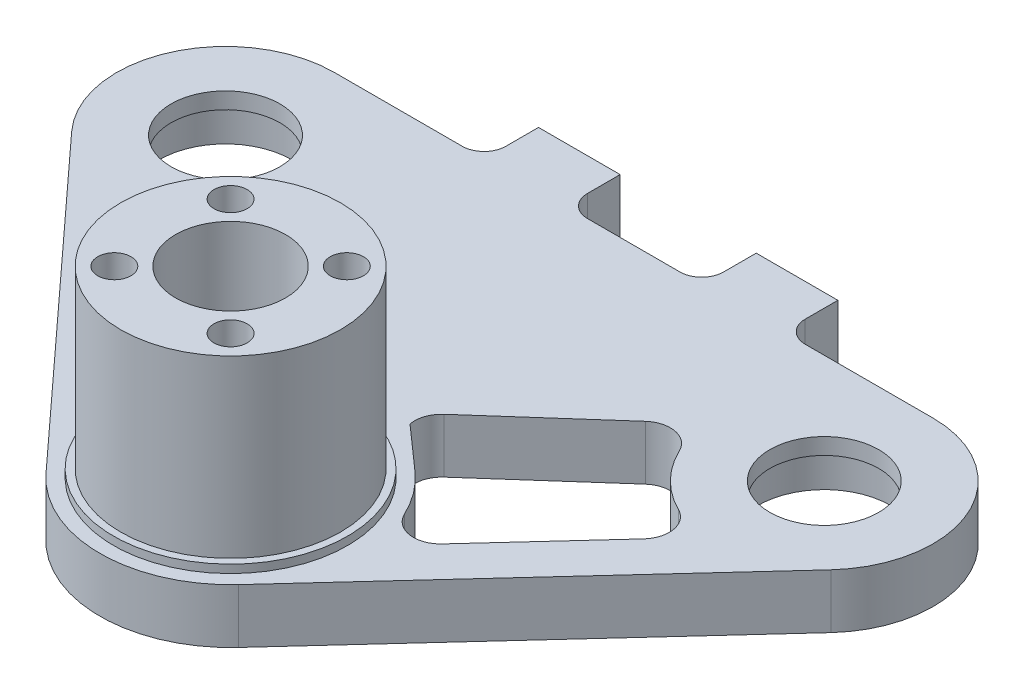
from build123d import *

# Parameters (mm, degrees)
SKETCH1_R                   = 10.1
SKETCH1_R_2                 = 10
MAIN_BODY_DEPTH             = 10
SKETCH2_R                   = 12.2
BEARING_RECESS_DEPTH        = 7
STANDOFF_SECTION_DEPTH      = 1.5
STANDOFF_SECTION_DEPTH_BACK = 11.5
SKETCH3_R                   = 21.5
SKETCH3_R_2                 = 10.1
SKETCH9_R                   = 20.2
SKETCH9_R_2                 = 10.1
BOSS_EXTRUDE1_DEPTH         = 33.7
EXTRA_GEOMETRY_DEPTH        = 10
SKETCH8_R                   = 2
CUT_EXTRUDE1_DEPTH          = 6
SKETCH4_R                   = 3.05
M6_BOLT_HOLES_DEPTH         = 122.389206984


with BuildPart() as part:
    # Sketch1 → Main Body (new body)
    with BuildSketch(Plane(origin=(0, 0, 0), x_dir=(1, 0, 0), z_dir=(0, 1, 0))):
        with BuildLine():
            Line((-69.741518057, 40.551033083), (-17.689821668, -16.219439242))
            ThreePointArc((-17.689821668, -16.219439242), (17.115072934, -16.824811395), (15.914514265, 17.96463848))
            Line((15.914514265, 17.96463848), (-41.737904779, 69.037764518))
            ThreePointArc((-41.737904779, 69.037764518), (-69.262560778, 68.087908614), (-69.741518057, 40.551033083))
        make_face()
        Circle(SKETCH1_R, mode=Mode.SUBTRACT)
        with Locations((-55, 54.067232452)):
            Circle(SKETCH1_R_2, mode=Mode.SUBTRACT)
        with BuildLine():
            Line((-47.625471592, 28.267691162), (-29.927098797, 8.964862385))
            ThreePointArc((-29.927098797, 8.964862385), (-25.488644513, 7.400949716), (-21.717284924, 10.215651499))
            ThreePointArc((-21.717284924, 10.215651499), (-17.115072934, 16.824811395), (-10.585592312, 21.539388))
            ThreePointArc((-10.585592312, 21.539388), (-7.835804554, 25.358336357), (-9.475400239, 29.769393516))
            Line((-9.475400239, 29.769393516), (-29.078104388, 47.135037426))
            ThreePointArc((-29.078104388, 47.135037426), (-33.398420323, 48.290403264), (-36.914902554, 45.527370018))
            ThreePointArc((-36.914902554, 45.527370018), (-40.737439222, 40.046556289), (-46.152073662, 36.130839294))
            ThreePointArc((-46.152073662, 36.130839294), (-48.85455966, 32.56761471), (-47.625471592, 28.267691162))
        make_face(mode=Mode.SUBTRACT)
    extrude(amount=MAIN_BODY_DEPTH)

    # Sketch2 → Bearing Recess (cut)
    with BuildSketch(Plane.XZ):
        with Locations((-55, -54.067232452)):
            Circle(SKETCH2_R)
    extrude(amount=-BEARING_RECESS_DEPTH, mode=Mode.SUBTRACT)

    # Sketch3 → Standoff Section (add, two sides: drawn at the far end of the back side and taken through both)
    with BuildSketch(Plane.XZ.offset(-STANDOFF_SECTION_DEPTH_BACK)):
        Circle(SKETCH3_R)
        Circle(SKETCH3_R_2, mode=Mode.SUBTRACT)
    extrude(amount=STANDOFF_SECTION_DEPTH + STANDOFF_SECTION_DEPTH_BACK)

    # Sketch9 → Boss-Extrude1 (add)
    with BuildSketch(Plane(origin=(0, 10, 0), x_dir=(1, 0, 0), z_dir=(0, 1, 0))):
        Circle(SKETCH9_R)
        Circle(SKETCH9_R_2, mode=Mode.SUBTRACT)
    extrude(amount=BOSS_EXTRUDE1_DEPTH)

    # Sketch6 → Extra Geometry (add)
    with BuildSketch(Plane(origin=(0, 0, 0), x_dir=(1, 0, 0), z_dir=(0, 1, 0))):
        with BuildLine():
            Line((0, 74.067232452), (0, 32.062988668))
            Line((0, 32.062988668), (-41.737904779, 69.037764518))
            ThreePointArc((-41.737904779, 69.037764518), (-47.908125823, 72.767642091), (-55, 74.067232452))
            Line((-55, 74.067232452), (-31.5, 74.067232452))
            ThreePointArc((-31.5, 74.067232452), (-28.671572875, 75.238805327), (-27.5, 78.067232452))
            Line((-27.5, 78.067232452), (-27.5, 84.067232452))
            Line((-27.5, 84.067232452), (-12.5, 84.067232452))
            Line((-12.5, 84.067232452), (-12.5, 78.067232452))
            ThreePointArc((-12.5, 78.067232452), (-11.328427125, 75.238805327), (-8.5, 74.067232452))
            Line((-8.5, 74.067232452), (0, 74.067232452))
        make_face()
    extrude(amount=EXTRA_GEOMETRY_DEPTH)

    # Sketch8 → Cut-Extrude1 (cut)
    with BuildSketch(Plane(origin=(0, 0, -84.067232452), x_dir=(-1, 0, 0), z_dir=(0, 0, -1))):
        with Locations((20, 5)):
            Circle(SKETCH8_R)
    extrude(amount=-CUT_EXTRUDE1_DEPTH, mode=Mode.SUBTRACT)

    # Mirror2: part across plane


with BuildPart() as part_1:
    add(part.part)
    add(part.part.mirror(Plane(origin=(0, 0, 0), x_dir=(0, 0, 1), z_dir=(1, 0, 0))))

    # Sketch4 → M6 Bolt holes (cut, through all)
    with BuildSketch(Plane.XZ.offset(1.5)):
        with Locations((-10.677312396, 10.677312396)):
            Circle(SKETCH4_R)
        with Locations((10.677312396, 10.677312396)):
            Circle(SKETCH4_R)
        with Locations((10.677312396, -10.677312396)):
            Circle(SKETCH4_R)
        with Locations((-10.677312396, -10.677312396)):
            Circle(SKETCH4_R)
    extrude(amount=-M6_BOLT_HOLES_DEPTH, mode=Mode.SUBTRACT)


solid = part_1.part
